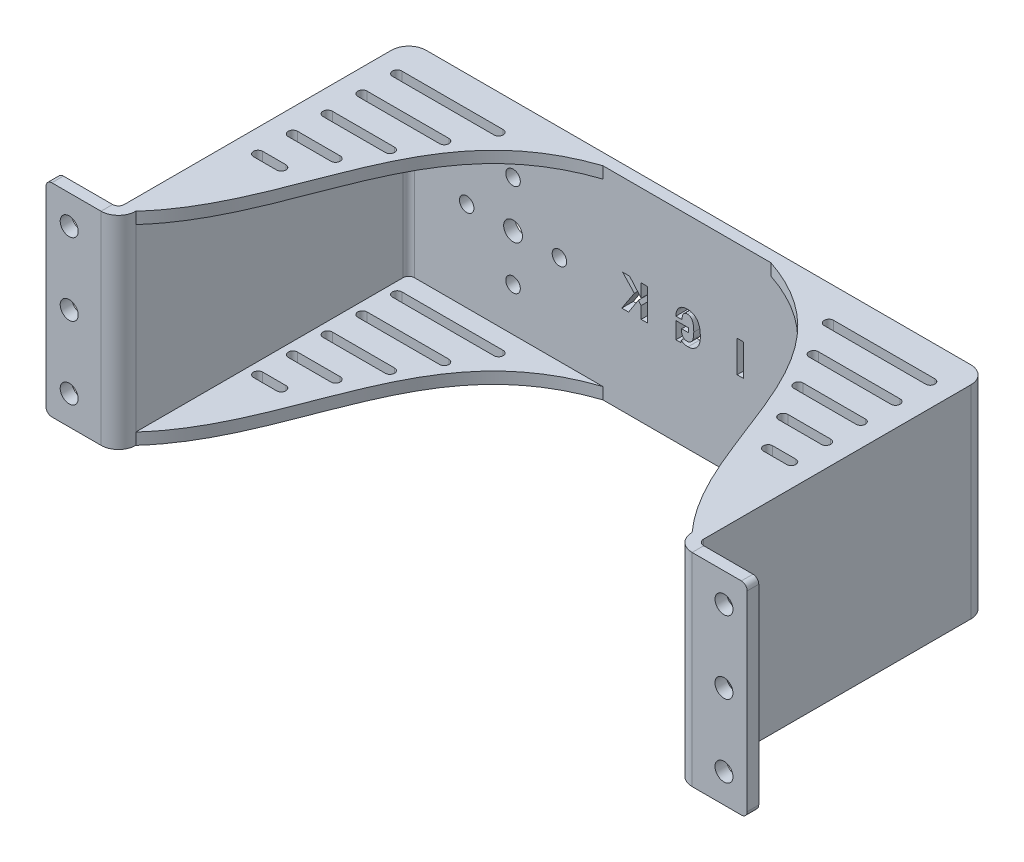
from build123d import *

# Parameters (mm, degrees)
SKETCH_1_W                         = 200
SKETCH_1_H                         = 70
SM_BASE_FLANGE_1_DEPTH             = 4
SM_EDGE_FLANGE_1_STRIP_W           = 20
SM_EDGE_FLANGE_1_STRIP_H           = 4
SM_EDGE_FLANGE_1_STRIP_CUT_DEPTH   = 70
SM_EDGE_FLANGE_1_STRIP_2_W         = 20
SM_EDGE_FLANGE_1_STRIP_2_H         = 4
SM_EDGE_FLANGE_1_STRIP_CUT_2_DEPTH = 70
SM_EDGE_FLANGE_1_DEPTH             = 70
SM_EDGE_FLANGE_1_BEND_DEPTH        = 70
SM_EDGE_FLANGE_2_STRIP_W           = 20
SM_EDGE_FLANGE_2_STRIP_H           = 4
SM_EDGE_FLANGE_2_STRIP_CUT_DEPTH   = 70
SM_EDGE_FLANGE_2_STRIP_2_W         = 20
SM_EDGE_FLANGE_2_STRIP_2_H         = 4
SM_EDGE_FLANGE_2_STRIP_CUT_2_DEPTH = 70
SM_EDGE_FLANGE_2_DEPTH             = 70
SM_EDGE_FLANGE_2_BEND_DEPTH        = 70
SKETCH_21_R                        = 3.25
SKETCH_21_R_2                      = 2.5
CUT_EXTRUDE_1_DEPTH                = 10
SKETCH_22_R                        = 3.1
CUT_EXTRUDE_2_DEPTH                = 10
FILLET_1_R                         = 2
EXTRUDE_1_DEPTH                    = 4
SKETCH_26_W                        = 2.199679049
SKETCH_26_H                        = 10.9140625
CUT_EXTRUDE_5_DEPTH                = 164.473667689


# Sheet-metal steps are written as plain solids
with BuildPart() as part:
    # Sketch 1 → 基体-法兰1 (new body)
    with BuildSketch(Plane.XY):
        Rectangle(SKETCH_1_W, SKETCH_1_H)
    extrude(amount=-SM_BASE_FLANGE_1_DEPTH)

    # 边线-法兰1 strip (across the edge) → 边线-法兰1 strip cut (cut)
    with BuildSketch(Plane(origin=(-100, 35, 0), x_dir=(1, 0, 0), z_dir=(0, -1, 0))):
        with Locations((-4, -2)):
            Rectangle(SM_EDGE_FLANGE_1_STRIP_W, SM_EDGE_FLANGE_1_STRIP_H)
    extrude(amount=SM_EDGE_FLANGE_1_STRIP_CUT_DEPTH, mode=Mode.SUBTRACT)

    # 边线-法兰1 strip 2 (across the edge) → 边线-法兰1 strip cut 2 (cut)
    with BuildSketch(Plane(origin=(100, -35, 0), x_dir=(-1, 0, 0), z_dir=(0, 1, 0))):
        with Locations((-4, -2)):
            Rectangle(SM_EDGE_FLANGE_1_STRIP_2_W, SM_EDGE_FLANGE_1_STRIP_2_H)
    extrude(amount=SM_EDGE_FLANGE_1_STRIP_CUT_2_DEPTH, mode=Mode.SUBTRACT)

    # 边线-法兰1 section (across the edge) → 边线-法兰1 (add)
    with BuildSketch(Plane(origin=(-100, 35, 0), x_dir=(1, 0, 0), z_dir=(0, -1, 0))):
        with BuildLine():
            Line((0, 2), (0, 100.2))
            Line((0, 100.2), (4, 100.2))
            Line((4, 100.2), (4, 2))
            ThreePointArc((4, 2), (4.585786438, 0.585786438), (6, 0))
            Line((6, 0), (6, -4))
            ThreePointArc((6, -4), (1.757359313, -2.242640687), (0, 2))
        make_face()
    extrude(amount=SM_EDGE_FLANGE_1_DEPTH)

    # 边线-法兰1 section 2 (across the edge) → 边线-法兰1 bend (add)
    with BuildSketch(Plane(origin=(100, -35, 0), x_dir=(-1, 0, 0), z_dir=(0, 1, 0))):
        with BuildLine():
            Line((0, 2), (0, 100.2))
            Line((0, 100.2), (4, 100.2))
            Line((4, 100.2), (4, 2))
            ThreePointArc((4, 2), (4.585786438, 0.585786438), (6, 0))
            Line((6, 0), (6, -4))
            ThreePointArc((6, -4), (1.757359313, -2.242640687), (0, 2))
        make_face()
    extrude(amount=SM_EDGE_FLANGE_1_BEND_DEPTH)

    # 边线-法兰2 strip (across the edge) → 边线-法兰2 strip cut (cut)
    with BuildSketch(Plane(origin=(-100, -35, 100.2), x_dir=(0, 0, -1), z_dir=(0, 1, 0))):
        with Locations((-4, -2)):
            Rectangle(SM_EDGE_FLANGE_2_STRIP_W, SM_EDGE_FLANGE_2_STRIP_H)
    extrude(amount=SM_EDGE_FLANGE_2_STRIP_CUT_DEPTH, mode=Mode.SUBTRACT)

    # 边线-法兰2 strip 2 (across the edge) → 边线-法兰2 strip cut 2 (cut)
    with BuildSketch(Plane(origin=(100, 35, 100.2), x_dir=(0, 0, -1), z_dir=(0, -1, 0))):
        with Locations((-4, -2)):
            Rectangle(SM_EDGE_FLANGE_2_STRIP_2_W, SM_EDGE_FLANGE_2_STRIP_2_H)
    extrude(amount=SM_EDGE_FLANGE_2_STRIP_CUT_2_DEPTH, mode=Mode.SUBTRACT)

    # 边线-法兰2 section (across the edge) → 边线-法兰2 (add)
    with BuildSketch(Plane(origin=(-100, -35, 100.2), x_dir=(0, 0, -1), z_dir=(0, 1, 0))):
        with BuildLine():
            Line((0, 2), (0, 21))
            Line((0, 21), (4, 21))
            Line((4, 21), (4, 2))
            ThreePointArc((4, 2), (4.585786438, 0.585786438), (6, 0))
            Line((6, 0), (6, -4))
            ThreePointArc((6, -4), (1.757359313, -2.242640687), (0, 2))
        make_face()
    extrude(amount=SM_EDGE_FLANGE_2_DEPTH)

    # 边线-法兰2 section 2 (across the edge) → 边线-法兰2 bend (add)
    with BuildSketch(Plane(origin=(100, 35, 100.2), x_dir=(0, 0, -1), z_dir=(0, -1, 0))):
        with BuildLine():
            Line((0, 2), (0, 21))
            Line((0, 21), (4, 21))
            Line((4, 21), (4, 2))
            ThreePointArc((4, 2), (4.585786438, 0.585786438), (6, 0))
            Line((6, 0), (6, -4))
            ThreePointArc((6, -4), (1.757359313, -2.242640687), (0, 2))
        make_face()
    extrude(amount=SM_EDGE_FLANGE_2_BEND_DEPTH)

    # 草图21 → 切除-拉伸1 (cut)
    with BuildSketch(Plane(origin=(0, 0, -4), x_dir=(-1, 0, 0), z_dir=(0, 0, -1))):
        with Locations((-60, 0)):
            Circle(SKETCH_21_R)
        with Locations(Location((60, 0, 0), (0, 0, 180))):
            Circle(SKETCH_21_R)
        with Locations((-60, -16)):
            Circle(SKETCH_21_R_2)
        with Locations((-76, 0)):
            Circle(SKETCH_21_R_2)
        with Locations((-44, 0)):
            Circle(SKETCH_21_R_2)
        with Locations((-60, 16)):
            Circle(SKETCH_21_R_2)
        with Locations(Location((76, 0, 0), (0, 0, 180))):
            Circle(SKETCH_21_R_2)
        with Locations(Location((60, 16, 0), (0, 0, 180))):
            Circle(SKETCH_21_R_2)
        with Locations(Location((44, 0, 0), (0, 0, 180))):
            Circle(SKETCH_21_R_2)
        with Locations(Location((60, -16, 0), (0, 0, 180))):
            Circle(SKETCH_21_R_2)
    extrude(amount=-CUT_EXTRUDE_1_DEPTH, mode=Mode.SUBTRACT)

    # 草图22 → 切除-拉伸2 (cut)
    with BuildSketch(Plane(origin=(0, 0, 96.2), x_dir=(-1, 0, 0), z_dir=(0, 0, -1))):
        with Locations((-113, 25)):
            Circle(SKETCH_22_R)
        with Locations((-113, -25)):
            Circle(SKETCH_22_R)
        with Locations((113, -25)):
            Circle(SKETCH_22_R)
        with Locations((113, 25)):
            Circle(SKETCH_22_R)
        with Locations((-113, 0)):
            Circle(SKETCH_22_R)
        with Locations((113, 0)):
            Circle(SKETCH_22_R)
    extrude(amount=-CUT_EXTRUDE_2_DEPTH, mode=Mode.SUBTRACT)

    # 圆角1
    fillet_1_edges = [part.edges().sort_by_distance(p)[0] for p in [
        (-121, -35, 98.2),
        (-121, 35, 98.2),
        (121, 35, 98.2),
        (121, -35, 98.2),
    ]]
    fillet(fillet_1_edges, radius=FILLET_1_R)

    # 草图25 → 凸台-拉伸1 (add)
    # profile 1 of 2: a face of its own
    with BuildSketch(Plane.XZ.offset(35)):
        with BuildLine():
            Line((-100, 94.2), (-100, 2))
            ThreePointArc((-100, 2), (-98.242640687, -2.242640687), (-94, -4))
            Line((-94, -4), (-29, -4))
            Line((-29, -4), (-29, 0))
            add(Edge.make_bspline(
                [(-96, 94.2), (-69.144881074, 64.454058246), (-75.07927277, 15.420400215), (-29, 0)],
                knots=[0, 0, 0, 0, 1, 1, 1, 1], degree=3))
            Line((-96, 94.2), (-100, 94.2))
        make_face()
        with BuildLine():
            Line((-92, 9.6), (-57, 9.6))
            ThreePointArc((-57, 9.6), (-55.4, 8), (-57, 6.4))
            Line((-57, 6.4), (-92, 6.4))
            ThreePointArc((-92, 6.4), (-93.6, 8), (-92, 9.6))
        make_face(mode=Mode.SUBTRACT)
        with BuildLine():
            Line((-92, 21.6), (-63.75, 21.6))
            ThreePointArc((-63.75, 21.6), (-62.15, 20), (-63.75, 18.4))
            Line((-63.75, 18.4), (-92, 18.4))
            ThreePointArc((-92, 18.4), (-93.6, 20), (-92, 21.6))
        make_face(mode=Mode.SUBTRACT)
        with BuildLine():
            Line((-92, 33.6), (-70.5, 33.6))
            ThreePointArc((-70.5, 33.6), (-68.9, 32), (-70.5, 30.4))
            Line((-70.5, 30.4), (-92, 30.4))
            ThreePointArc((-92, 30.4), (-93.6, 32), (-92, 33.6))
        make_face(mode=Mode.SUBTRACT)
        with BuildLine():
            Line((-92, 45.6), (-77.25, 45.6))
            ThreePointArc((-77.25, 45.6), (-75.65, 44), (-77.25, 42.4))
            Line((-77.25, 42.4), (-92, 42.4))
            ThreePointArc((-92, 42.4), (-93.6, 44), (-92, 45.6))
        make_face(mode=Mode.SUBTRACT)
        with BuildLine():
            Line((-92, 57.6), (-84, 57.6))
            ThreePointArc((-84, 57.6), (-82.4, 56), (-84, 54.4))
            Line((-84, 54.4), (-92, 54.4))
            ThreePointArc((-92, 54.4), (-93.6, 56), (-92, 57.6))
        make_face(mode=Mode.SUBTRACT)
    # profile 2 of 2: a face of its own
    with BuildSketch(Plane.XZ.offset(35)):
        with BuildLine():
            Line((29, -4), (94, -4))
            ThreePointArc((94, -4), (98.242640687, -2.242640687), (100, 2))
            Line((100, 2), (100, 94.2))
            Line((100, 94.2), (96, 94.2))
            add(Edge.make_bspline(
                [(96, 94.2), (69.144881074, 64.454058246), (75.07927277, 15.420400215), (29, 0)],
                knots=[0, 0, 0, 0, 1, 1, 1, 1], degree=3))
            Line((29, 0), (29, -4))
        make_face()
        with BuildLine():
            Line((92, 57.6), (84, 57.6))
            ThreePointArc((84, 57.6), (82.4, 56), (84, 54.4))
            Line((84, 54.4), (92, 54.4))
            ThreePointArc((92, 54.4), (93.6, 56), (92, 57.6))
        make_face(mode=Mode.SUBTRACT)
        with BuildLine():
            Line((92, 45.6), (77.25, 45.6))
            ThreePointArc((77.25, 45.6), (75.65, 44), (77.25, 42.4))
            Line((77.25, 42.4), (92, 42.4))
            ThreePointArc((92, 42.4), (93.6, 44), (92, 45.6))
        make_face(mode=Mode.SUBTRACT)
        with BuildLine():
            Line((92, 33.6), (70.5, 33.6))
            ThreePointArc((70.5, 33.6), (68.9, 32), (70.5, 30.4))
            Line((70.5, 30.4), (92, 30.4))
            ThreePointArc((92, 30.4), (93.6, 32), (92, 33.6))
        make_face(mode=Mode.SUBTRACT)
        with BuildLine():
            Line((92, 21.6), (63.75, 21.6))
            ThreePointArc((63.75, 21.6), (62.15, 20), (63.75, 18.4))
            Line((63.75, 18.4), (92, 18.4))
            ThreePointArc((92, 18.4), (93.6, 20), (92, 21.6))
        make_face(mode=Mode.SUBTRACT)
        with BuildLine():
            Line((92, 9.6), (57, 9.6))
            ThreePointArc((57, 9.6), (55.4, 8), (57, 6.4))
            Line((57, 6.4), (92, 6.4))
            ThreePointArc((92, 6.4), (93.6, 8), (92, 9.6))
        make_face(mode=Mode.SUBTRACT)
    extrude_1 = extrude(amount=-EXTRUDE_1_DEPTH)

    # 镜向1: 凸台-拉伸1 across plane
    add(extrude_1.mirror(Plane.ZX))

    # 草图26 → 切除-拉伸5 (cut, through all)
    with BuildSketch(Plane(origin=(0, 0, -4), x_dir=(-1, 0, 0), z_dir=(0, 0, -1))):
        Polygon((22.486096138, -4.318266722), (20.124779332, -4.318266722), (16.728043847, 0.957214872), (15.786328216, -0.207045497), (15.786328216, -4.318266722), (13.586649167, -4.318266722), (13.586649167, 6.595795778), (15.786328216, 6.595795778), (15.786328216, 2.002003856), (19.764022598, 6.595795778), (22.181561233, 6.595795778), (18.147645022, 2.280770423), align=None)
        with BuildLine():
            Line((3.796086211, -4.442423261), (2.086005588, -4.442423261))
            Line((2.086005588, -4.442423261), (1.931395559, -3.573327492))
            add(Edge.make_bspline(
                [(1.931395559, -3.573327492), (1.926403748, -3.599504238), (1.915954761, -3.654298084), (1.873376968, -3.732394566), (1.810277142, -3.808867604), (1.724372916, -3.882775177), (1.618812517, -3.957769493), (1.491339132, -4.029892714), (1.342146926, -4.099976684), (1.115035504, -4.192649206), (0.809383422, -4.295862096), (0.423065968, -4.37663223), (0.023955195, -4.434890747), (-0.247760699, -4.43989042), (-0.3854123, -4.442423261)],
                knots=[0, 0, 0, 0, 0.367872324, 0.770039915, 1.216730627, 1.738557517, 2.336777855, 3.011353041, 3.767319191, 4.622369419, 6.414150491, 8.233203709, 10.091736441, 12, 12, 12, 12], degree=3))
            add(Edge.make_bspline(
                [(-0.3854123, -4.442423261), (-0.522283049, -4.439096552), (-0.79340378, -4.432506833), (-1.194431757, -4.371329533), (-1.584143972, -4.274056067), (-1.961577234, -4.133372438), (-2.327866705, -3.957181519), (-2.684501202, -3.743287963), (-3.025615008, -3.485301548), (-3.356771909, -3.194570669), (-3.665337039, -2.860624867), (-3.925862707, -2.471003049), (-4.15404845, -2.040712892), (-4.331462101, -1.559807343), (-4.475197357, -1.036544761), (-4.57355202, -0.465404863), (-4.634987895, 0.150798925), (-4.642618424, 0.577562757), (-4.646558401, 0.797919691)],
                knots=[0, 0, 0, 0, 0.863015735, 1.709506645, 2.553053729, 3.393155719, 4.245873851, 5.11439785, 6.011985286, 6.940263632, 7.892329147, 8.870682637, 9.888727012, 10.958306145, 12.097247074, 13.30810321, 14.61005531, 16, 16, 16, 16], degree=3))
            add(Edge.make_bspline(
                [(-4.646558401, 0.797919691), (-4.643299231, 1.037771471), (-4.636994194, 1.501777497), (-4.579045943, 2.174434029), (-4.490241564, 2.800971566), (-4.362217234, 3.381717324), (-4.196273872, 3.916654122), (-3.993440804, 4.405159639), (-3.75350392, 4.848046866), (-3.476464261, 5.243168489), (-3.166167167, 5.591800023), (-2.826309141, 5.893020294), (-2.462062517, 6.152075178), (-2.066846218, 6.358022806), (-1.646574943, 6.520923459), (-1.199719533, 6.638369737), (-0.724850189, 6.706579315), (-0.399690024, 6.715422756), (-0.233144847, 6.719952316)],
                knots=[0, 0, 0, 0, 1.375786968, 2.661533072, 3.870351097, 5.003979523, 6.069491906, 7.079531229, 8.033785603, 8.953501932, 9.841917872, 10.705034325, 11.553919453, 12.399571307, 13.254804187, 14.134958991, 15.044736656, 16, 16, 16, 16], degree=3))
            add(Edge.make_bspline(
                [(-0.233144847, 6.719952316), (-0.077628346, 6.716098029), (0.224915881, 6.708599838), (0.665969161, 6.657827708), (1.079497399, 6.567685445), (1.468566247, 6.44783845), (1.829169932, 6.287556599), (2.16121104, 6.091126787), (2.469459775, 5.863866036), (2.744227428, 5.59692361), (2.992747258, 5.305925818), (3.206877418, 4.988347878), (3.391061419, 4.651073169), (3.537468277, 4.289491405), (3.656739453, 3.908475604), (3.736794367, 3.503192276), (3.787237355, 3.076187418), (3.793095276, 2.783791063), (3.796086211, 2.634499429)],
                knots=[0, 0, 0, 0, 1.149707753, 2.236659403, 3.276077409, 4.274765415, 5.241302493, 6.185815442, 7.122160454, 8.065314048, 9.011430989, 9.946493873, 10.891888473, 11.847067087, 12.82578454, 13.839048351, 14.896662023, 16, 16, 16, 16], degree=3))
            Line((3.796086211, 2.634499429), (1.671369601, 2.634499429))
            add(Edge.make_bspline(
                [(1.671369601, 2.634499429), (1.670283629, 2.746983029), (1.668192029, 2.963628375), (1.644977865, 3.275830326), (1.604813018, 3.56359277), (1.552196307, 3.826819108), (1.485361806, 4.066906109), (1.398494841, 4.280055043), (1.297510279, 4.469553495), (1.181941592, 4.636294451), (1.050074044, 4.779377366), (0.904708134, 4.902661998), (0.748430245, 5.008997178), (0.576610838, 5.093068118), (0.393656647, 5.162564428), (0.19575002, 5.207718599), (-0.014408293, 5.236924052), (-0.158857923, 5.24013528), (-0.233144847, 5.241786736)],
                knots=[0, 0, 0, 0, 1.463999323, 2.819687859, 4.071732706, 5.24386686, 6.311957299, 7.31045671, 8.233633353, 9.102144367, 9.943832552, 10.75857571, 11.578942429, 12.397165384, 13.243016731, 14.120698557, 15.033521069, 16, 16, 16, 16], degree=3))
            add(Edge.make_bspline(
                [(-0.233144847, 5.241786736), (-0.31458176, 5.2394286), (-0.474056482, 5.234810755), (-0.706536298, 5.188288973), (-0.925774475, 5.11444388), (-1.129400115, 5.005926188), (-1.321271476, 4.872136259), (-1.497721643, 4.705085919), (-1.661740027, 4.510595423), (-1.811241662, 4.283613771), (-1.946885137, 4.020145786), (-2.059927864, 3.710588757), (-2.154087674, 3.355790099), (-2.232732298, 2.956604754), (-2.29575038, 2.512511738), (-2.338895248, 2.023030514), (-2.364132989, 1.487685941), (-2.367711057, 1.115757989), (-2.369574338, 0.922076229)],
                knots=[0, 0, 0, 0, 0.726205559, 1.422099938, 2.107722768, 2.784355774, 3.474816818, 4.189997424, 4.946905538, 5.741555941, 6.611415185, 7.5864302, 8.677187488, 9.885753198, 11.216677769, 12.679657109, 14.270928947, 16, 16, 16, 16], degree=3))
            add(Edge.make_bspline(
                [(-2.369574338, 0.922076229), (-2.367388429, 0.739296127), (-2.363199625, 0.389039059), (-2.329959295, -0.113618586), (-2.278856099, -0.570130903), (-2.201414407, -0.980271402), (-2.10485095, -1.344508898), (-1.986084754, -1.664153896), (-1.845353114, -1.938459393), (-1.677387378, -2.164744157), (-1.496980629, -2.351156138), (-1.316122982, -2.514088153), (-1.133263705, -2.6540837), (-0.944947725, -2.767869641), (-0.752335558, -2.853849718), (-0.558269991, -2.919134527), (-0.35964881, -2.958035518), (-0.225503287, -2.962178518), (-0.158182409, -2.964257681)],
                knots=[0, 0, 0, 0, 1.759211495, 3.371134242, 4.846969215, 6.178115309, 7.385151598, 8.469842527, 9.454934395, 10.34188754, 11.17127105, 11.948397926, 12.683496471, 13.384729748, 14.060902781, 14.709789129, 15.352508171, 16, 16, 16, 16], degree=3))
            add(Edge.make_bspline(
                [(-0.158182409, -2.964257681), (-0.083150034, -2.962349338), (0.063462413, -2.958620458), (0.276752396, -2.932807042), (0.477991573, -2.889932888), (0.667599481, -2.833645869), (0.843052675, -2.753606283), (1.007317186, -2.661109946), (1.159069437, -2.549423432), (1.297898879, -2.420164333), (1.422781745, -2.271903841), (1.530910598, -2.10406049), (1.622654989, -1.916988651), (1.698193094, -1.709867082), (1.751639433, -1.482202388), (1.795759256, -1.236912154), (1.81729136, -0.971101643), (1.821470807, -0.787250518), (1.823637054, -0.69195877)],
                knots=[0, 0, 0, 0, 1.045265698, 2.042437845, 2.987637411, 3.909831655, 4.791278577, 5.668351047, 6.53216725, 7.409644428, 8.305276389, 9.225607937, 10.184049458, 11.202709032, 12.289767329, 13.437977518, 14.67207993, 16, 16, 16, 16], degree=3))
            Line((1.823637054, -0.69195877), (1.823637054, -0.160193973))
            Line((1.823637054, -0.160193973), (-0.535337176, -0.160193973))
            Line((-0.535337176, -0.160193973), (-0.535337176, 1.320314183))
            Line((-0.535337176, 1.320314183), (3.796086211, 1.320314183))
            Line((3.796086211, 1.320314183), (3.796086211, -4.442423261))
        make_face()
        with Locations((-18.430042484, 1.138764528)):
            Rectangle(SKETCH_26_W, SKETCH_26_H)
    extrude(amount=-CUT_EXTRUDE_5_DEPTH, mode=Mode.SUBTRACT)


solid = part.part
